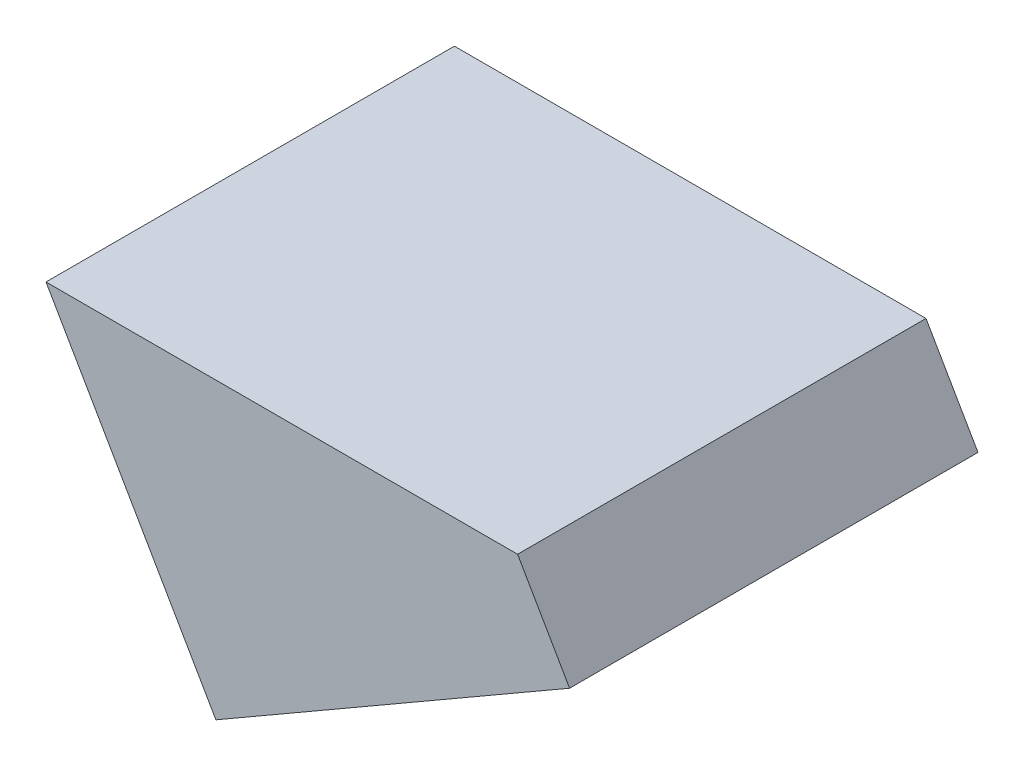
from build123d import *

# Parameters (mm, degrees)
ESBO_O1_W                = 30
ESBO_O1_H                = 30
RESSALTO_EXTRUS_O1_DEPTH = 22.775
CORTE_EXTRUS_O1_DEPTH    = 41.542577927
ESBO_O3_OUTSIDE_W        = 48.998
ESBO_O3_OUTSIDE_H        = 41.63
ESBO_O3_OUTSIDE_W_2      = 30
ESBO_O3_OUTSIDE_H_2      = 30
CORTE_EXTRUS_O2_DEPTH    = 30.010251575
RESSALTO_EXTRUS_O2_DEPTH = 30


with BuildPart() as part:
    # Esboço1 → Ressalto-extrusão1 (new body)
    with BuildSketch(Plane(origin=(0, 0, 0), x_dir=(1, 0, 0), z_dir=(0, 1, 0))):
        Rectangle(ESBO_O1_W, ESBO_O1_H)
    extrude(amount=RESSALTO_EXTRUS_O1_DEPTH)

    # Esboço2 → Corte-extrusão1 (cut, through all)
    with BuildSketch(Plane.XY.offset(15)):
        Polygon((-15, 0), (15, 17.320508076), (15, 0), align=None)
    extrude(amount=-CORTE_EXTRUS_O1_DEPTH, mode=Mode.SUBTRACT)

    # Esboço3 outside → Corte-extrusão2 (cut, through all)
    with BuildSketch(Plane(origin=(-3.75, 6.495190528, 0), x_dir=(0.8660254037844378, 0.5000000000000017, 0), z_dir=(0.5000000000000016, -0.8660254037844377, 0))):
        with Locations((5.694, 0)):
            Rectangle(ESBO_O3_OUTSIDE_W, ESBO_O3_OUTSIDE_H)
        with Locations((4.330127019, 0)):
            Rectangle(ESBO_O3_OUTSIDE_W_2, ESBO_O3_OUTSIDE_H_2, mode=Mode.SUBTRACT)
    extrude(amount=-CORTE_EXTRUS_O2_DEPTH, mode=Mode.SUBTRACT)

    # Esboço4 → Ressalto-extrusão2 (add)
    with BuildSketch(Plane.XY.offset(15)):
        Polygon((-25.469660456, 22.775), (-15, 4.641016151), (-15, 22.775), align=None)
    extrude(amount=-RESSALTO_EXTRUS_O2_DEPTH)


solid = part.part
